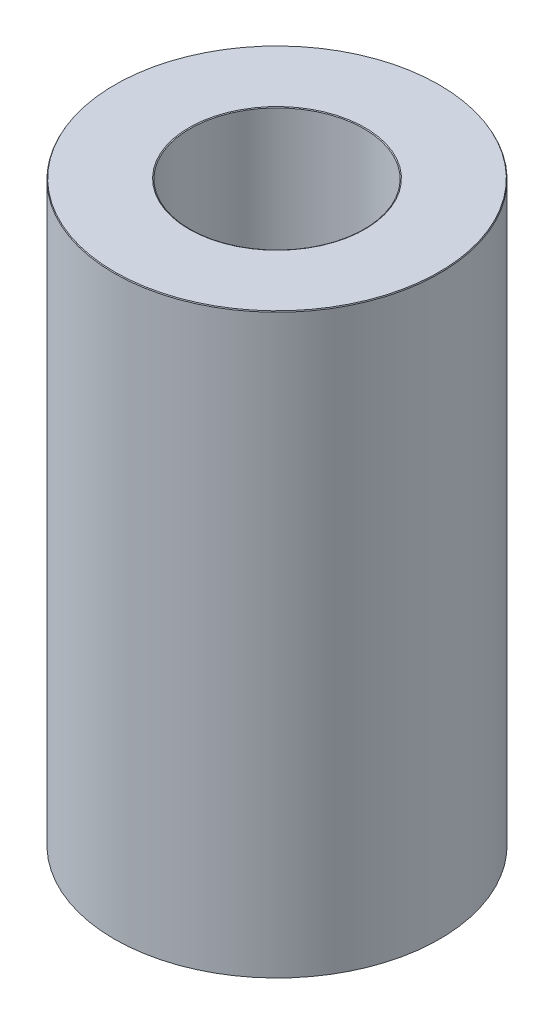
from build123d import *
from OCP.BRepFilletAPI import BRepFilletAPI_MakeChamfer

# Parameters (mm, degrees)
SKETCH1_R           = 47.5
BOSS_EXTRUDE1_DEPTH = 168.735248258
SKETCH2_R           = 25.42732235
CUT_EXTRUDE1_DEPTH  = 182.615208627
CHAMFER1_SIZE       = 0.26143188
CHAMFER1_SIZE2      = 0.150937767


with BuildPart() as part:
    # Sketch1 → Boss-Extrude1 (new body)
    with BuildSketch(Plane(origin=(0, 0, 0), x_dir=(1, 0, 0), z_dir=(0, 1, 0))):
        Circle(SKETCH1_R)
    extrude(amount=BOSS_EXTRUDE1_DEPTH)

    # Sketch2 → Cut-Extrude1 (cut, through all)
    with BuildSketch(Plane(origin=(0, 0, 0), x_dir=(1, 0, 0), z_dir=(0, 1, 0))):
        Circle(SKETCH2_R)
    extrude(amount=CUT_EXTRUDE1_DEPTH, mode=Mode.SUBTRACT)

    # Chamfer1: one chamfer whose edges measure the first distance from different faces: ONE call of the kernel's chamfer builder (chamfer() names one face for all edges)
    chamfer1_edges_1 = [part.edges().sort_by_distance(p)[0] for p in [
        (-25.42732235, 168.735248258, 0),
    ]]
    chamfer1_side_1 = [part.faces().sort_by_distance(p)[0] for p in [
        (-46.156497116, 168.735248258, 0),
    ]]
    chamfer1_edges_2 = [part.edges().sort_by_distance(p)[0] for p in [
        (-25.42732235, 0, 0),
    ]]
    chamfer1_side_2 = [part.faces().sort_by_distance(p)[0] for p in [
        (-25.42732235, 84.367624129, 0),
    ]]
    chamfer1_edges_3 = [part.edges().sort_by_distance(p)[0] for p in [
        (-47.5, 0, 0),
    ]]
    chamfer1_side_3 = [part.faces().sort_by_distance(p)[0] for p in [
        (-46.156497116, 0, 0),
    ]]
    chamfer1_edges_4 = [part.edges().sort_by_distance(p)[0] for p in [
        (-47.5, 168.735248258, 0),
    ]]
    chamfer1_side_4 = [part.faces().sort_by_distance(p)[0] for p in [
        (-47.5, 84.367624129, 0),
    ]]
    chamfer1 = BRepFilletAPI_MakeChamfer(part.part.solid().wrapped)
    for e in chamfer1_edges_1:
        chamfer1.Add(CHAMFER1_SIZE, CHAMFER1_SIZE2, e.wrapped, chamfer1_side_1[0].wrapped)  # the first distance lies on this face
    for e in chamfer1_edges_2:
        chamfer1.Add(CHAMFER1_SIZE, CHAMFER1_SIZE2, e.wrapped, chamfer1_side_2[0].wrapped)  # the first distance lies on this face
    for e in chamfer1_edges_3:
        chamfer1.Add(CHAMFER1_SIZE, CHAMFER1_SIZE2, e.wrapped, chamfer1_side_3[0].wrapped)  # the first distance lies on this face
    for e in chamfer1_edges_4:
        chamfer1.Add(CHAMFER1_SIZE, CHAMFER1_SIZE2, e.wrapped, chamfer1_side_4[0].wrapped)  # the first distance lies on this face
    add(Compound.cast(chamfer1.Shape()), mode=Mode.REPLACE)


solid = part.part
